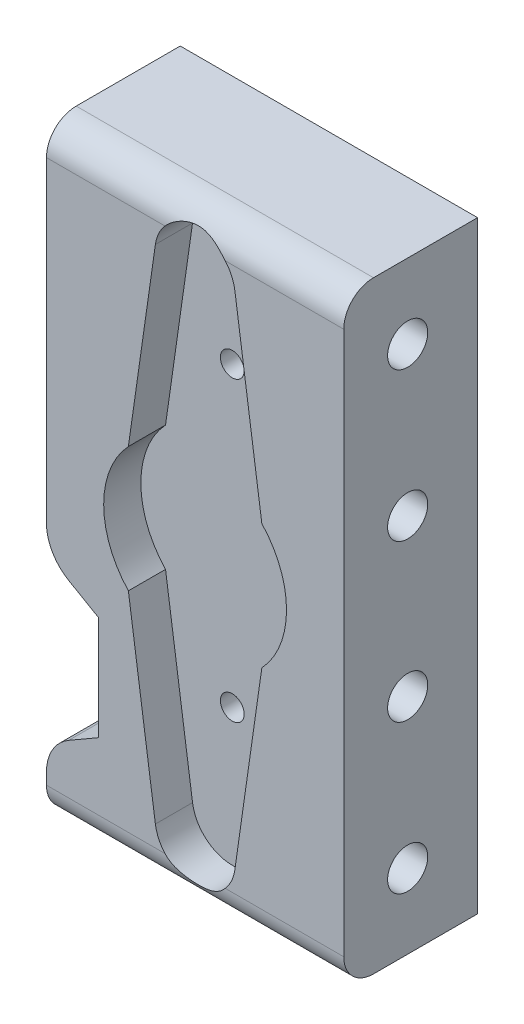
from build123d import *
from OCP.BRepFilletAPI import BRepFilletAPI_MakeChamfer

# Parameters (mm, degrees)
SKETCH1_W           = 20
SKETCH1_H           = 40.56076
BOSS_EXTRUDE1_DEPTH = 9
SKETCH6_R           = 1.35
CUT_EXTRUDE1_DEPTH  = 10
CUT_EXTRUDE2_DEPTH  = 2.5
FILLET1_R           = 2
SKETCH9_R           = 0.8
CUT_EXTRUDE3_DEPTH  = 6.5
SKETCH10_W          = 9
SKETCH10_H          = 7
CUT_EXTRUDE4_DEPTH  = 3.5
CHAMFER1_SIZE       = 2.020725942
CHAMFER1_SIZE_2     = 3.5
FILLET2_R           = 3


# Some blends are built 0.0001 mm under size
with BuildPart() as part:
    # Sketch1 → Boss-Extrude1 (new body)
    with BuildSketch(Plane.XY):
        Rectangle(SKETCH1_W, SKETCH1_H)
    extrude(amount=-BOSS_EXTRUDE1_DEPTH)

    # Sketch6 → Cut-Extrude1 (cut)
    with BuildSketch(Plane(origin=(10, 0, 0), x_dir=(0, 0, -1), z_dir=(1, 0, 0))):
        with Locations(Location((4.3, -15.26519, 0), (0, 0, 180))):
            Circle(SKETCH6_R)
        with Locations((4.3, -5.26519)):
            Circle(SKETCH6_R)
        with Locations((4.3, 15.26519)):
            Circle(SKETCH6_R)
        with Locations(Location((4.3, 5.26519, 0), (0, 0, 180))):
            Circle(SKETCH6_R)
    extrude(amount=-CUT_EXTRUDE1_DEPTH, mode=Mode.SUBTRACT)

    # Sketch8 → Cut-Extrude2 (cut)
    with BuildSketch(Plane.XY):
        with BuildLine():
            Line((-4.488964362, -4.203771991), (-2.672717394, -16.882859941))
            ThreePointArc((-2.672717394, -16.882859941), (0, -19.2), (2.672717394, -16.882859941))
            Line((2.672717394, -16.882859941), (4.488964362, -4.203771991))
            ThreePointArc((4.488964362, -4.203771991), (6.15, 0), (4.488964362, 4.203771991))
            Line((4.488964362, 4.203771991), (2.672717394, 16.882859941))
            ThreePointArc((2.672717394, 16.882859941), (0, 19.2), (-2.672717394, 16.882859941))
            Line((-2.672717394, 16.882859941), (-4.488964362, 4.203771991))
            ThreePointArc((-4.488964362, 4.203771991), (-6.15, 0), (-4.488964362, -4.203771991))
        make_face()
    extrude(amount=-CUT_EXTRUDE2_DEPTH, mode=Mode.SUBTRACT)

    # Fillet1
    # the kernel refuses this fillet: 2 mm, written as the material it takes off along each edge
    with BuildSketch(Plane(origin=(-15, -20.28038, 0), x_dir=(0, 0, -1), z_dir=(1, 0, 0)), Plane(origin=(15, 20.28038, 0), x_dir=(0, 0, -1), z_dir=(-1, 0, 0))) as fillet1_piece_1:
        with BuildLine():
            CenterArc((FILLET1_R, FILLET1_R), FILLET1_R, 180, 90)
            Line((0, FILLET1_R), (0, 0))
            Line((0, 0), (FILLET1_R, 0))
        make_face()
    extrude(amount=30, mode=Mode.SUBTRACT)

    # Sketch9 → Cut-Extrude3 (cut)
    with BuildSketch(Plane.XY.offset(-2.5)):
        with Locations((0, 10)):
            Circle(SKETCH9_R)
        with Locations((0, -10)):
            Circle(SKETCH9_R)
    extrude(amount=-CUT_EXTRUDE3_DEPTH, mode=Mode.SUBTRACT)

    # Sketch10 → Cut-Extrude4 (cut)
    with BuildSketch(Plane.ZY.offset(10)):
        with Locations((-4.5, -10.26517)):
            Rectangle(SKETCH10_W, SKETCH10_H)
    extrude(amount=-CUT_EXTRUDE4_DEPTH, mode=Mode.SUBTRACT)

    # Chamfer1
    chamfer1_edges_1 = [part.edges().sort_by_distance(p)[0] for p in [
        (-10, -6.76517, -4.5),
    ]]
    chamfer1_side_1 = [part.faces().sort_by_distance(p)[0] for p in [
        (-10, -6.724755481, -4.5),
    ]]
    chamfer1_edges_2 = [part.edges().sort_by_distance(p)[0] for p in [
        (-10, -13.76517, -4.5),
    ]]
    chamfer1_side_2 = [part.faces().sort_by_distance(p)[0] for p in [
        (-10, -13.805584519, -4.5),
    ]]
    chamfer1 = BRepFilletAPI_MakeChamfer(part.part.solid().wrapped)
    for e in chamfer1_edges_1:
        chamfer1.Add(CHAMFER1_SIZE - 0.0001, CHAMFER1_SIZE_2 - 0.0001, e.wrapped, chamfer1_side_1[0].wrapped)
    for e in chamfer1_edges_2:
        chamfer1.Add(CHAMFER1_SIZE - 0.0001, CHAMFER1_SIZE_2 - 0.0001, e.wrapped, chamfer1_side_2[0].wrapped)
    add(Compound.cast(chamfer1.Shape()), mode=Mode.REPLACE)  # a hair under: the kernel refuses the full size

    # Fillet2
    fillet2_edges = [part.edges().sort_by_distance(p)[0] for p in [
        (-10, -4.744544058, -4.5),
        (-10, -15.785795942, -4.5),
    ]]
    fillet(fillet2_edges, radius=FILLET2_R)


solid = part.part
